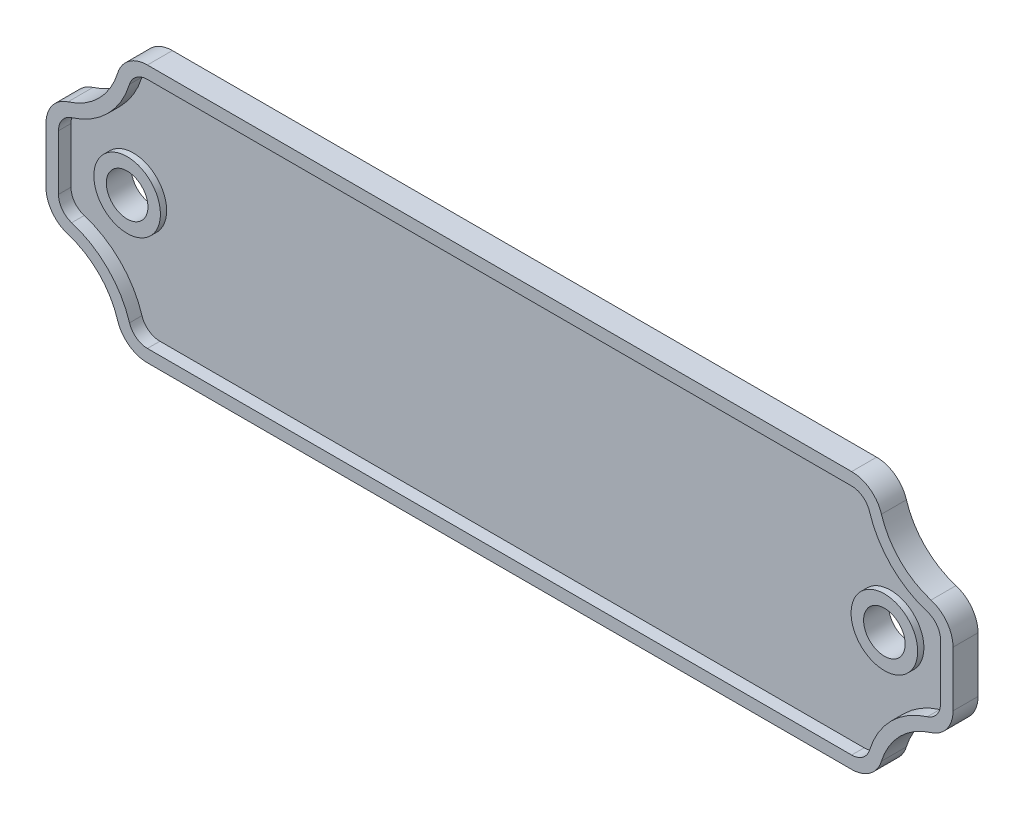
from build123d import *

# Parameters (mm, degrees)
SKETCH2_R           = 4
BOSS_EXTRUDE1_DEPTH = 1.5
BOSS_EXTRUDE2_DEPTH = 3
SKETCH2_4_R         = 4
SKETCH2_4_R_2       = 2.5
BOSS_EXTRUDE3_DEPTH = 2.25
BOSS_EXTRUDE4_START = -0.75
SKETCH2_5_R         = 4
SKETCH2_5_R_2       = 2.5
BOSS_EXTRUDE4_DEPTH = 0.75


with BuildPart() as part:
    # Sketch2 → Boss-Extrude1 (new body)
    with BuildSketch(Plane.XY):
        with BuildLine():
            Line((42.313942393, 14), (-42.313942393, 14))
            ThreePointArc((-42.313942393, 14), (-43.650641576, 13.55989925), (-44.464423147, 12.411764706))
            ThreePointArc((-44.464423147, 12.411764706), (-47.075378798, 8.075378798), (-51.411764706, 5.464423147))
            ThreePointArc((-51.411764706, 5.464423147), (-52.55989925, 4.650641576), (-53, 3.313942393))
            Line((-53, 3.313942393), (-53, -3.313942393))
            ThreePointArc((-53, -3.313942393), (-52.55989925, -4.650641576), (-51.411764706, -5.464423147))
            ThreePointArc((-51.411764706, -5.464423147), (-47.075378798, -8.075378798), (-44.464423147, -12.411764706))
            ThreePointArc((-44.464423147, -12.411764706), (-43.650641576, -13.55989925), (-42.313942393, -14))
            Line((-42.313942393, -14), (42.313942393, -14))
            ThreePointArc((42.313942393, -14), (43.650641576, -13.55989925), (44.464423147, -12.411764706))
            ThreePointArc((44.464423147, -12.411764706), (47.075378798, -8.075378798), (51.411764706, -5.464423147))
            ThreePointArc((51.411764706, -5.464423147), (52.55989925, -4.650641576), (53, -3.313942393))
            Line((53, -3.313942393), (53, 3.313942393))
            ThreePointArc((53, 3.313942393), (52.55989925, 4.650641576), (51.411764706, 5.464423147))
            ThreePointArc((51.411764706, 5.464423147), (47.075378798, 8.075378798), (44.464423147, 12.411764706))
            ThreePointArc((44.464423147, 12.411764706), (43.650641576, 13.55989925), (42.313942393, 14))
        make_face()
        with Locations((-45.5, 0)):
            Circle(SKETCH2_R, mode=Mode.SUBTRACT)
        with Locations((45.5, 0)):
            Circle(SKETCH2_R, mode=Mode.SUBTRACT)
    extrude(amount=BOSS_EXTRUDE1_DEPTH)

    # Sketch2<3> → Boss-Extrude2 (add)
    with BuildSketch(Plane.XY):
        with BuildLine():
            Line((-42.313942393, -15.5), (0, -15.5))
            Line((0, -15.5), (42.313942393, -15.5))
            ThreePointArc((42.313942393, -15.5), (44.541774365, -14.76649875), (45.898076983, -12.852941176))
            ThreePointArc((45.898076983, -12.852941176), (48.136038969, -9.136038969), (51.852941176, -6.898076983))
            ThreePointArc((51.852941176, -6.898076983), (53.76649875, -5.541774365), (54.5, -3.313942393))
            Line((54.5, -3.313942393), (54.5, 3.313942393))
            ThreePointArc((54.5, 3.313942393), (53.76649875, 5.541774365), (51.852941176, 6.898076983))
            ThreePointArc((51.852941176, 6.898076983), (48.136038969, 9.136038969), (45.898076983, 12.852941176))
            ThreePointArc((45.898076983, 12.852941176), (44.541774365, 14.76649875), (42.313942393, 15.5))
            Line((42.313942393, 15.5), (-42.313942393, 15.5))
            ThreePointArc((-42.313942393, 15.5), (-44.541774365, 14.76649875), (-45.898076983, 12.852941176))
            ThreePointArc((-45.898076983, 12.852941176), (-48.136038969, 9.136038969), (-51.852941176, 6.898076983))
            ThreePointArc((-51.852941176, 6.898076983), (-53.76649875, 5.541774365), (-54.5, 3.313942393))
            Line((-54.5, 3.313942393), (-54.5, -3.313942393))
            ThreePointArc((-54.5, -3.313942393), (-53.76649875, -5.541774365), (-51.852941176, -6.898076983))
            ThreePointArc((-51.852941176, -6.898076983), (-48.136038969, -9.136038969), (-45.898076983, -12.852941176))
            ThreePointArc((-45.898076983, -12.852941176), (-44.541774365, -14.76649875), (-42.313942393, -15.5))
        make_face()
        with BuildLine():
            ThreePointArc((-44.464423147, 12.411764706), (-43.650641576, 13.55989925), (-42.313942393, 14))
            Line((-42.313942393, 14), (42.313942393, 14))
            ThreePointArc((42.313942393, 14), (43.650641576, 13.55989925), (44.464423147, 12.411764706))
            ThreePointArc((44.464423147, 12.411764706), (47.075378798, 8.075378798), (51.411764706, 5.464423147))
            ThreePointArc((51.411764706, 5.464423147), (52.55989925, 4.650641576), (53, 3.313942393))
            Line((53, 3.313942393), (53, -3.313942393))
            ThreePointArc((53, -3.313942393), (52.55989925, -4.650641576), (51.411764706, -5.464423147))
            ThreePointArc((51.411764706, -5.464423147), (47.075378798, -8.075378798), (44.464423147, -12.411764706))
            ThreePointArc((44.464423147, -12.411764706), (43.650641576, -13.55989925), (42.313942393, -14))
            Line((42.313942393, -14), (-42.313942393, -14))
            ThreePointArc((-42.313942393, -14), (-43.650641576, -13.55989925), (-44.464423147, -12.411764706))
            ThreePointArc((-44.464423147, -12.411764706), (-47.075378798, -8.075378798), (-51.411764706, -5.464423147))
            ThreePointArc((-51.411764706, -5.464423147), (-52.55989925, -4.650641576), (-53, -3.313942393))
            Line((-53, -3.313942393), (-53, 3.313942393))
            ThreePointArc((-53, 3.313942393), (-52.55989925, 4.650641576), (-51.411764706, 5.464423147))
            ThreePointArc((-51.411764706, 5.464423147), (-47.075378798, 8.075378798), (-44.464423147, 12.411764706))
        make_face(mode=Mode.SUBTRACT)
    extrude(amount=BOSS_EXTRUDE2_DEPTH)

    # Sketch2<4> → Boss-Extrude3 (add)
    # profile 1 of 2: a face of its own
    with BuildSketch(Plane.XY):
        with Locations((-45.5, 0)):
            Circle(SKETCH2_4_R)
        with Locations((-45.5, 0)):
            Circle(SKETCH2_4_R_2, mode=Mode.SUBTRACT)
    # profile 2 of 2: a face of its own
    with BuildSketch(Plane.XY):
        with Locations((45.5, 0)):
            Circle(SKETCH2_4_R)
        with Locations((45.5, 0)):
            Circle(SKETCH2_4_R_2, mode=Mode.SUBTRACT)
    extrude(amount=BOSS_EXTRUDE3_DEPTH)

    # Sketch2<5> → Boss-Extrude4 (add)
    # profile 1 of 2: a face of its own
    with BuildSketch(Plane.XY.offset(BOSS_EXTRUDE4_START)):
        with Locations((-45.5, 0)):
            Circle(SKETCH2_5_R)
        with Locations((-45.5, 0)):
            Circle(SKETCH2_5_R_2, mode=Mode.SUBTRACT)
    # profile 2 of 2: a face of its own
    with BuildSketch(Plane.XY.offset(BOSS_EXTRUDE4_START)):
        with Locations((45.5, 0)):
            Circle(SKETCH2_5_R)
        with Locations((45.5, 0)):
            Circle(SKETCH2_5_R_2, mode=Mode.SUBTRACT)
    extrude(amount=BOSS_EXTRUDE4_DEPTH)


solid = part.part
